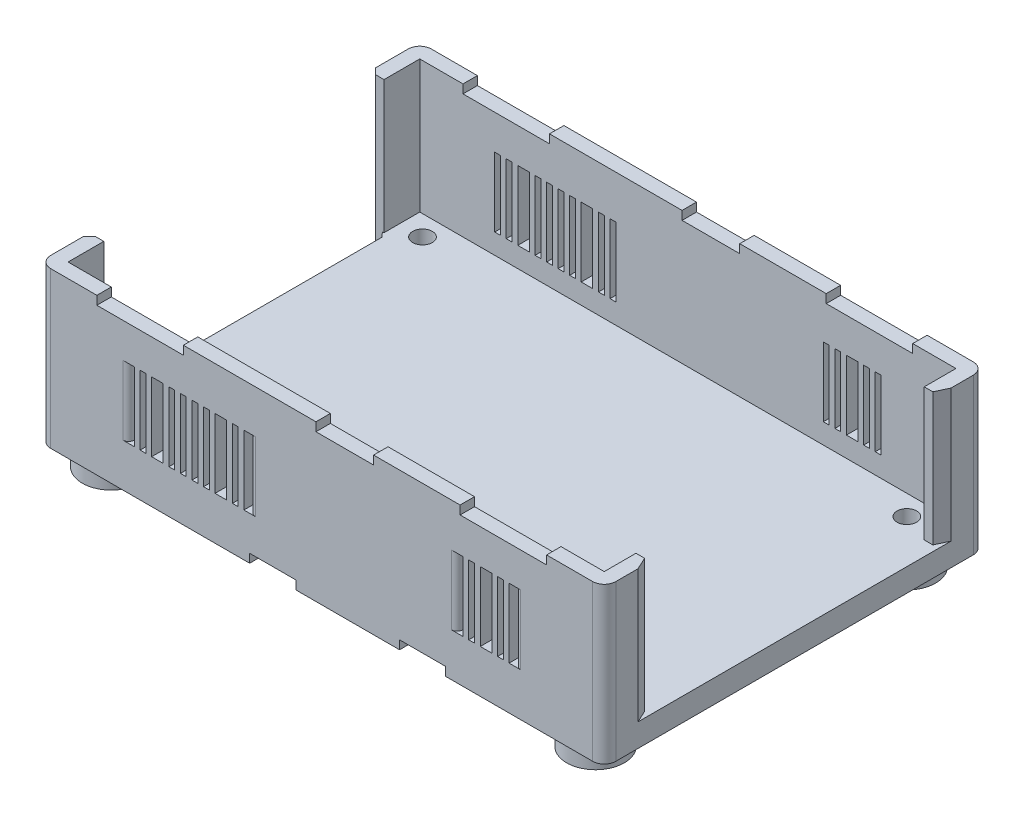
from build123d import *
from OCP.BRepFilletAPI import BRepFilletAPI_MakeChamfer
from build123d.topology import SkipClean

# Parameters (mm, degrees)
SKETCH1_W            = 94.996
SKETCH1_H            = 66
SKETCH1_R            = 1.7
BOSS_EXTRUDE2_DEPTH  = 4
SKETCH2_R            = 4.995073186
SKETCH2_R_2          = 2.75
BOSS_EXTRUDE3_DEPTH  = 3.5
SKETCH3_W            = 94.996
SKETCH3_H            = 2.5
BOSS_EXTRUDE4_DEPTH  = 23
BOSS_EXTRUDE6_DEPTH  = 1.5
BOSS_EXTRUDE7_DEPTH  = 3
SKETCH9_W            = 2.5
SKETCH9_H            = 23
BOSS_EXTRUDE8_DEPTH  = 6.2
SKETCH10_W           = 2.5
SKETCH10_H           = 23
BOSS_EXTRUDE9_DEPTH  = 6.2
BOSS_EXTRUDE10_START = 4
BOSS_EXTRUDE10_DEPTH = 4
CHAMFER1_SIZE        = 1
SKETCH12_W           = 2.5
SKETCH12_H           = 5.5
BOSS_EXTRUDE11_DEPTH = 23
CHAMFER2_SIZE        = 1
CHAMFER2_SIZE2       = 2.144506921
SKETCH13_W           = 1
SKETCH13_H           = 12
SKETCH13_W_2         = 2
CUT_EXTRUDE2_DEPTH   = 86.506128459
CUT_EXTRUDE3_START   = 12
CUT_EXTRUDE3_DEPTH   = 8
CUT_EXTRUDE4_START   = -6
CUT_EXTRUDE4_DEPTH   = 8
CUT_EXTRUDE5_REACH   = 89.379
SKETCH20_W           = 10
SKETCH20_H           = 1.5
SKETCH20_W_2         = 15
FILLET1_START        = 25.5
FILLET1_OUTLINE_W    = 10
FILLET1_OUTLINE_H    = 2.5
FILLET1_OUTLINE_W_2  = 15
FILLET1_DEPTH        = 1.5
FILLET1_START_2      = -1
FILLET1_2_DEPTH      = 26.5
FILLET2_R            = 1


with BuildPart() as part:
    # Sketch1 → Boss-Extrude2 (new body)
    with BuildSketch(Plane(origin=(0, 0, 0), x_dir=(1, 0, 0), z_dir=(0, 1, 0))):
        Rectangle(SKETCH1_W, SKETCH1_H)
        with Locations(Location((-44.02, 27, 0), (0, 0, 270))):
            Circle(SKETCH1_R, mode=Mode.SUBTRACT)
        with Locations(Location((-44.02, -27, 0), (0, 0, 270))):
            Circle(SKETCH1_R, mode=Mode.SUBTRACT)
        with Locations(Location((39.98, 27, 0), (0, 0, 270))):
            Circle(SKETCH1_R, mode=Mode.SUBTRACT)
        with Locations(Location((39.98, -27, 0), (0, 0, 270))):
            Circle(SKETCH1_R, mode=Mode.SUBTRACT)
    extrude(amount=BOSS_EXTRUDE2_DEPTH)

    # Sketch2 → Boss-Extrude3 (add)
    # profile 1 of 4: a face of its own
    with BuildSketch(Plane(origin=(0, 0, 0), x_dir=(-1, 0, 0), z_dir=(0, -1, 0))):
        with Locations(Location((44.02, 27, 0), (0, 0, 314.129791109))):
            Circle(SKETCH2_R)
        with Locations(Location((44.02, 27, 0), (0, 0, 90))):
            Circle(SKETCH2_R_2, mode=Mode.SUBTRACT)
    # profile 2 of 4: a face of its own
    with BuildSketch(Plane(origin=(0, 0, 0), x_dir=(-1, 0, 0), z_dir=(0, -1, 0))):
        with Locations(Location((44.02, -27, 0), (0, 0, 314.129791109))):
            Circle(SKETCH2_R)
        with Locations(Location((44.02, -27, 0), (0, 0, 90))):
            Circle(SKETCH2_R_2, mode=Mode.SUBTRACT)
    # profile 3 of 4: a face of its own
    with BuildSketch(Plane(origin=(0, 0, 0), x_dir=(-1, 0, 0), z_dir=(0, -1, 0))):
        with Locations(Location((-39.98, -27, 0), (0, 0, 270))):
            Circle(SKETCH2_R)
        with Locations(Location((-39.98, -27, 0), (0, 0, 90))):
            Circle(SKETCH2_R_2, mode=Mode.SUBTRACT)
    # profile 4 of 4: a face of its own
    with BuildSketch(Plane(origin=(0, 0, 0), x_dir=(-1, 0, 0), z_dir=(0, -1, 0))):
        with Locations(Location((-39.98, 27, 0), (0, 0, 270))):
            Circle(SKETCH2_R)
        with Locations(Location((-39.98, 27, 0), (0, 0, 90))):
            Circle(SKETCH2_R_2, mode=Mode.SUBTRACT)
    extrude(amount=BOSS_EXTRUDE3_DEPTH)

    # Sketch3 → Boss-Extrude4 (add)
    with BuildSketch(Plane(origin=(0, 4, 0), x_dir=(1, 0, 0), z_dir=(0, 1, 0))):
        with Locations((0, -31.75)):
            Rectangle(SKETCH3_W, SKETCH3_H)
        with Locations((0, 31.75)):
            Rectangle(SKETCH3_W, SKETCH3_H)
    extrude(amount=BOSS_EXTRUDE4_DEPTH)

    # Sketch6 → Boss-Extrude6 (add)
    with BuildSketch(Plane.XZ):
        with BuildLine():
            Line((-39.068879891, 27.661185149), (35.028879891, 27.661185149))
            ThreePointArc((35.028879891, 27.661185149), (34.985734682, 26.910166423), (35.05586091, 26.161185149))
            Line((35.05586091, 26.161185149), (-39.09586091, 26.161185149))
            ThreePointArc((-39.09586091, 26.161185149), (-39.025734682, 26.910166423), (-39.068879891, 27.661185149))
        make_face()
        with BuildLine():
            Line((-44.77, -22.061553267), (-44.77, 22.061553267))
            ThreePointArc((-44.77, 22.061553267), (-44.02, 22.004926814), (-43.27, 22.061553267))
            Line((-43.27, 22.061553267), (-43.27, -22.061553267))
            ThreePointArc((-43.27, -22.061553267), (-44.02, -22.004926814), (-44.77, -22.061553267))
        make_face()
        with BuildLine():
            Line((-39.09586091, -26.161185149), (35.05586091, -26.161185149))
            ThreePointArc((35.05586091, -26.161185149), (34.985734682, -26.910166423), (35.028879891, -27.661185149))
            Line((35.028879891, -27.661185149), (-39.068879891, -27.661185149))
            ThreePointArc((-39.068879891, -27.661185149), (-39.025734682, -26.910166423), (-39.09586091, -26.161185149))
        make_face()
        with BuildLine():
            Line((39.23, 22.061553267), (39.23, -22.061553267))
            ThreePointArc((39.23, -22.061553267), (39.98, -22.004926814), (40.73, -22.061553267))
            Line((40.73, -22.061553267), (40.73, 22.061553267))
            ThreePointArc((40.73, 22.061553267), (39.98, 22.004926814), (39.23, 22.061553267))
        make_face()
    extrude(amount=BOSS_EXTRUDE6_DEPTH)

    # Sketch8 → Boss-Extrude7 (add)
    with BuildSketch(Plane.ZY.offset(47.498)):
        Polygon((24.3, 0), (24.3, 4), (30.5, 4), (30.5, 27), (33, 27), (33, 0), align=None)
        Polygon((-24.3, 4), (-24.3, 0), (-33, 0), (-33, 27), (-30.5, 27), (-30.5, 4), align=None)
    extrude(amount=BOSS_EXTRUDE7_DEPTH)

    # Sketch9 → Boss-Extrude8 (add)
    with BuildSketch(Plane.XY.offset(-30.5)):
        with Locations((-49.248, 15.5)):
            Rectangle(SKETCH9_W, SKETCH9_H)
    extrude(amount=BOSS_EXTRUDE8_DEPTH)

    # Sketch10 → Boss-Extrude9 (add)
    with BuildSketch(Plane(origin=(0, 0, 30.5), x_dir=(-1, 0, 0), z_dir=(0, 0, -1))):
        with Locations((49.248, 15.5)):
            Rectangle(SKETCH10_W, SKETCH10_H)
    extrude(amount=BOSS_EXTRUDE9_DEPTH)

    # Sketch11 → Boss-Extrude10 (add)
    with SkipClean():  # the faces are left unmerged after this step: merging them gives an invalid solid
        with BuildSketch(Plane(origin=(0, 0, 0), x_dir=(1, 0, 0), z_dir=(0, 1, 0)).offset(BOSS_EXTRUDE10_START)):
            with BuildLine():
                Line((-47.498, 24.3), (-48.222470242, 24.3))
                ThreePointArc((-48.222470242, 24.3), (-47.885661443, 23.836549709), (-47.498, 23.414714497))
                Line((-47.498, 23.414714497), (-47.498, 24.3))
            make_face()
            with BuildLine():
                Line((-48.222470242, -24.3), (-47.498, -24.3))
                Line((-47.498, -24.3), (-47.498, -23.414714497))
                ThreePointArc((-47.498, -23.414714497), (-47.885661443, -23.836549709), (-48.222470242, -24.3))
            make_face()
        extrude(amount=-BOSS_EXTRUDE10_DEPTH)

    # Chamfer1
    chamfer1_edges = [part.edges().sort_by_distance(p)[0] for p in [
        (-50.498, 13.5, 24.3),
        (-50.498, 13.5, -24.3),
    ]]
    chamfer(chamfer1_edges, length=CHAMFER1_SIZE)

    # Sketch12 → Boss-Extrude11 (add)
    with BuildSketch(Plane(origin=(0, 4, 0), x_dir=(1, 0, 0), z_dir=(0, 1, 0))):
        with Locations((46.248, -27.75)):
            Rectangle(SKETCH12_W, SKETCH12_H)
        with Locations((46.248, 27.75)):
            Rectangle(SKETCH12_W, SKETCH12_H)
    extrude(amount=BOSS_EXTRUDE11_DEPTH)

    # Chamfer2: one chamfer whose edges measure the first distance from different faces: ONE call of the kernel's chamfer builder (chamfer() names one face for all edges)
    chamfer2_edges_1 = [part.edges().sort_by_distance(p)[0] for p in [
        (47.498, 15.5, 25),
    ]]
    chamfer2_side_1 = [part.faces().sort_by_distance(p)[0] for p in [
        (46.248, 15.5, 25),
    ]]
    chamfer2_edges_2 = [part.edges().sort_by_distance(p)[0] for p in [
        (47.498, 15.5, -25),
    ]]
    chamfer2_side_2 = [part.faces().sort_by_distance(p)[0] for p in [
        (46.248, 15.5, -25),
    ]]
    chamfer2 = BRepFilletAPI_MakeChamfer(part.part.solid().wrapped)
    for e in chamfer2_edges_1:
        chamfer2.Add(CHAMFER2_SIZE, CHAMFER2_SIZE2, e.wrapped, chamfer2_side_1[0].wrapped)  # the first distance lies on this face
    for e in chamfer2_edges_2:
        chamfer2.Add(CHAMFER2_SIZE, CHAMFER2_SIZE2, e.wrapped, chamfer2_side_2[0].wrapped)  # the first distance lies on this face
    add(Compound.cast(chamfer2.Shape()), mode=Mode.REPLACE)

    # Sketch13 → Cut-Extrude2 (cut, through all)
    with BuildSketch(Plane.XY.offset(-30.5)):
        with Locations((-34.498, 13.5)):
            Rectangle(SKETCH13_W, SKETCH13_H)
        with Locations((-27.498, 13.5)):
            Rectangle(SKETCH13_W, SKETCH13_H)
        with Locations((-29.998, 13.5)):
            Rectangle(SKETCH13_W_2, SKETCH13_H)
        with Locations((-32.498, 13.5)):
            Rectangle(SKETCH13_W, SKETCH13_H)
        with Locations((-25.498, 13.5)):
            Rectangle(SKETCH13_W, SKETCH13_H)
        with Locations((22.498, 13.5)):
            Rectangle(SKETCH13_W, SKETCH13_H)
        with Locations((29.498, 13.5)):
            Rectangle(SKETCH13_W, SKETCH13_H)
        with Locations((26.998, 13.5)):
            Rectangle(SKETCH13_W_2, SKETCH13_H)
        with Locations((24.498, 13.5)):
            Rectangle(SKETCH13_W, SKETCH13_H)
        with Locations((31.498, 13.5)):
            Rectangle(SKETCH13_W, SKETCH13_H)
        with Locations((-23.498, 13.5)):
            Rectangle(SKETCH13_W, SKETCH13_H)
        with Locations((-16.498, 13.5)):
            Rectangle(SKETCH13_W, SKETCH13_H)
        with Locations((-18.998, 13.5)):
            Rectangle(SKETCH13_W_2, SKETCH13_H)
        with Locations((-21.498, 13.5)):
            Rectangle(SKETCH13_W, SKETCH13_H)
        with Locations((-14.498, 13.5)):
            Rectangle(SKETCH13_W, SKETCH13_H)
    cut_extrude2 = extrude(amount=-CUT_EXTRUDE2_DEPTH, mode=Mode.SUBTRACT)

    # Sketch17 → Cut-Extrude3 (cut)
    with BuildSketch(Plane(origin=(0, 0, 0), x_dir=(0, 0, -1), z_dir=(1, 0, 0)).offset(CUT_EXTRUDE3_START)):
        Polygon((31.5, 0), (33, 0), (33, 1.5), align=None)
    cut_extrude3 = extrude(amount=CUT_EXTRUDE3_DEPTH, mode=Mode.SUBTRACT)

    # Sketch17<2> → Cut-Extrude4 (cut)
    with BuildSketch(Plane(origin=(0, 0, 0), x_dir=(0, 0, -1), z_dir=(1, 0, 0)).offset(CUT_EXTRUDE4_START)):
        Polygon((31.5, 0), (33, 0), (33, 1.5), align=None)
    cut_extrude4 = extrude(amount=-CUT_EXTRUDE4_DEPTH, mode=Mode.SUBTRACT)

    # Mirror1: Cut-Extrude2, Cut-Extrude3, Cut-Extrude4 across plane
    add(cut_extrude2.mirror(Plane.XY), mode=Mode.SUBTRACT)
    add(cut_extrude3.mirror(Plane.XY), mode=Mode.SUBTRACT)
    add(cut_extrude4.mirror(Plane.XY), mode=Mode.SUBTRACT)

    # Sketch20 → Cut-Extrude5 (cut, up to next)
    with BuildSketch(Plane(origin=(0, 0, -33), x_dir=(-1, 0, 0), z_dir=(0, 0, -1)), mode=Mode.PRIVATE) as cut_extrude5_sk1:
        with Locations((-2.498, 26.25)):
            Rectangle(SKETCH20_W, SKETCH20_H)
    cut_extrude5_tool1 = extrude(cut_extrude5_sk1.sketch, amount=-CUT_EXTRUDE5_REACH, mode=Mode.PRIVATE) & part.part
    # Sketch20 → Cut-Extrude5 (cut, up to next)
    with BuildSketch(Plane(origin=(0, 0, -33), x_dir=(-1, 0, 0), z_dir=(0, 0, -1)), mode=Mode.PRIVATE) as cut_extrude5_sk2:
        with Locations((-29.998, 26.25)):
            Rectangle(SKETCH20_W_2, SKETCH20_H)
    cut_extrude5_tool2 = extrude(cut_extrude5_sk2.sketch, amount=-CUT_EXTRUDE5_REACH, mode=Mode.PRIVATE) & part.part
    # Sketch20 → Cut-Extrude5 (cut, up to next)
    with BuildSketch(Plane(origin=(0, 0, -33), x_dir=(-1, 0, 0), z_dir=(0, 0, -1)), mode=Mode.PRIVATE) as cut_extrude5_sk3:
        with Locations((32.998, 26.25)):
            Rectangle(SKETCH20_W_2, SKETCH20_H)
    cut_extrude5_tool3 = extrude(cut_extrude5_sk3.sketch, amount=-CUT_EXTRUDE5_REACH, mode=Mode.PRIVATE) & part.part
    add(cut_extrude5_tool1.solids().sort_by_distance((2.498, 26.25, -33))[0], mode=Mode.SUBTRACT)
    add(cut_extrude5_tool2.solids().sort_by_distance((29.998, 26.25, -33))[0], mode=Mode.SUBTRACT)
    add(cut_extrude5_tool3.solids().sort_by_distance((-32.998, 26.25, -33))[0], mode=Mode.SUBTRACT)

    # Fillet1: read off the stored shape, not the designer's step
    # Fillet1 outline → Fillet1 (cut)
    with BuildSketch(Plane(origin=(0, 0, 0), x_dir=(1, 0, 0), z_dir=(0, 1, 0)).offset(FILLET1_START)):
        with Locations((2.498, -31.75)):
            Rectangle(FILLET1_OUTLINE_W, FILLET1_OUTLINE_H)
        with BuildLine():
            Line((-50.498, -33), (-48.498, -33))
            ThreePointArc((-48.498, -33), (-49.912213562, -32.414213562), (-50.498, -31))
            Line((-50.498, -31), (-50.498, -33))
        make_face()
        with BuildLine():
            ThreePointArc((-50.498, 31), (-49.912213562, 32.414213562), (-48.498, 33))
            Line((-48.498, 33), (-50.498, 33))
            Line((-50.498, 33), (-50.498, 31))
        make_face()
        with BuildLine():
            ThreePointArc((45.498, 33), (46.912213562, 32.414213562), (47.498, 31))
            Line((47.498, 31), (47.498, 33))
            Line((47.498, 33), (45.498, 33))
        make_face()
        with BuildLine():
            ThreePointArc((47.498, -31), (46.912213562, -32.414213562), (45.498, -33))
            Line((45.498, -33), (47.498, -33))
            Line((47.498, -33), (47.498, -31))
        make_face()
        with Locations((-32.998, -31.75)):
            Rectangle(FILLET1_OUTLINE_W_2, FILLET1_OUTLINE_H)
        with Locations((29.998, -31.75)):
            Rectangle(FILLET1_OUTLINE_W_2, FILLET1_OUTLINE_H)
    extrude(amount=FILLET1_DEPTH, mode=Mode.SUBTRACT)

    # Fillet1 2 outline → Fillet1 2 (cut)
    with BuildSketch(Plane(origin=(0, 0, 0), x_dir=(1, 0, 0), z_dir=(0, 1, 0)).offset(FILLET1_START_2)):
        with BuildLine():
            Line((-50.498, -33), (-48.498, -33))
            ThreePointArc((-48.498, -33), (-49.912213562, -32.414213562), (-50.498, -31))
            Line((-50.498, -31), (-50.498, -33))
        make_face()
        with BuildLine():
            ThreePointArc((-50.498, 31), (-49.912213562, 32.414213562), (-48.498, 33))
            Line((-48.498, 33), (-50.498, 33))
            Line((-50.498, 33), (-50.498, 31))
        make_face()
        with BuildLine():
            ThreePointArc((45.498, 33), (46.912213562, 32.414213562), (47.498, 31))
            Line((47.498, 31), (47.498, 33))
            Line((47.498, 33), (45.498, 33))
        make_face()
        with BuildLine():
            ThreePointArc((47.498, -31), (46.912213562, -32.414213562), (45.498, -33))
            Line((45.498, -33), (47.498, -33))
            Line((47.498, -33), (47.498, -31))
        make_face()
    extrude(amount=FILLET1_2_DEPTH, mode=Mode.SUBTRACT)

    # Fillet2
    fillet2_edges = [part.edges().sort_by_distance(p)[0] for p in [
        (-34.998, 13.5, -33),
        (31.998, 13.5, -33),
        (-13.998, 13.5, -33),
        (21.998, 13.5, -33),
        (-34.998, 13.5, 33),
        (31.998, 13.5, 33),
        (-13.998, 13.5, 33),
        (21.998, 13.5, 33),
    ]]
    fillet(fillet2_edges, radius=FILLET2_R)


solid = part.part
